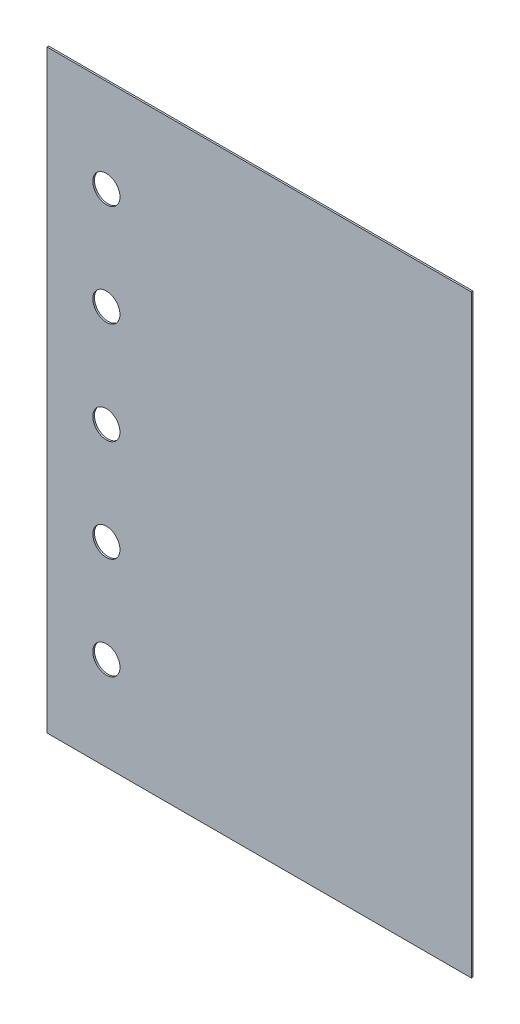
from build123d import *

# Parameters (mm, degrees)
SKETCH1_W           = 350
SKETCH1_H           = 250
BOSS_EXTRUDE1_DEPTH = 1
SKETCH3_R           = 8
CUT_EXTRUDE2_DEPTH  = 216.060456616


with BuildPart() as part:
    # Sketch1 → Boss-Extrude1 (new body)
    with BuildSketch(Plane(origin=(0, 0, 0), x_dir=(0, 1, 0), z_dir=(0, 0, 1))):
        Rectangle(SKETCH1_W, SKETCH1_H)
    extrude(amount=BOSS_EXTRUDE1_DEPTH)

    # Sketch3 → Cut-Extrude2 (cut, through all)
    with BuildSketch(Plane(origin=(0, 0, 1), x_dir=(0, -1, 0), z_dir=(0, 0, 1))):
        with Locations((120, -90)):
            Circle(SKETCH3_R)
        with Locations((60, -90)):
            Circle(SKETCH3_R)
        with Locations((0, -90)):
            Circle(SKETCH3_R)
        with Locations((-60, -90)):
            Circle(SKETCH3_R)
        with Locations((-120, -90)):
            Circle(SKETCH3_R)
    extrude(amount=-CUT_EXTRUDE2_DEPTH, mode=Mode.SUBTRACT)


solid = part.part
